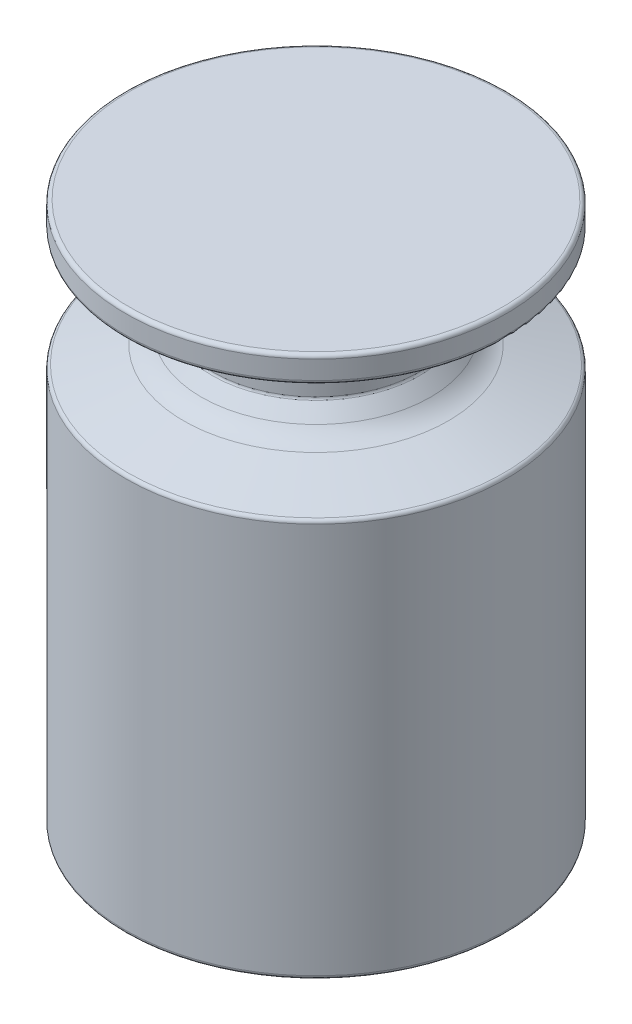
from build123d import *

# Parameters (mm, degrees)
FILLET1_R = 5
FILLET2_R = 0.5


with BuildPart() as part:
    # Sketch1 → Revolve1 (revolve)
    with BuildSketch(Plane.XY):
        Polygon((25, 32.25), (16, 29.4123109), (13.5, 26.45), (13.5, 22.45), (16, 19.4876891), (25, 16.65), (25, -35.55), (0, -35.55), (0, 35.55), (25, 35.55), align=None)
    revolve(axis=Axis((0, 67.092271098, 0), (0, -1, 0)))

    # Fillet1
    fillet1_edges = [part.edges().sort_by_distance(p)[0] for p in [
        (-16, 19.4876891, 0),
        (-16, 29.4123109, 0),
    ]]
    fillet(fillet1_edges, radius=FILLET1_R)

    # Fillet2
    fillet2_edges = [part.edges().sort_by_distance(p)[0] for p in [
        (-13.5, 26.45, 0),
        (-13.5, 22.45, 0),
        (-25, -35.55, 0),
        (-25, 16.65, 0),
        (-25, 32.25, 0),
        (-25, 35.55, 0),
    ]]
    fillet(fillet2_edges, radius=FILLET2_R)


solid = part.part
